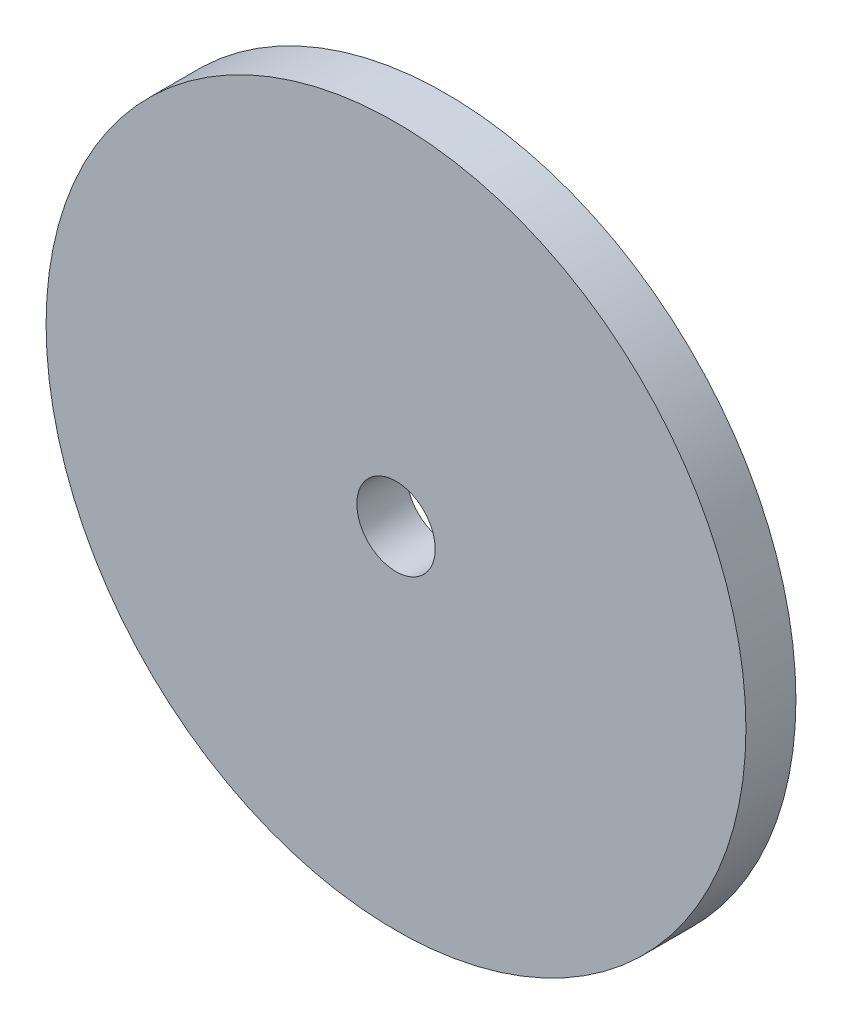
from build123d import *

# Parameters (mm, degrees)
SKETCH1_R           = 22.225
SKETCH1_R_2         = 2.4892
BOSS_EXTRUDE1_DEPTH = 3.175


with BuildPart() as part:
    # Sketch1 → Boss-Extrude1 (new body)
    with BuildSketch(Plane.XY):
        Circle(SKETCH1_R)
        Circle(SKETCH1_R_2, mode=Mode.SUBTRACT)
    extrude(amount=BOSS_EXTRUDE1_DEPTH)


solid = part.part
